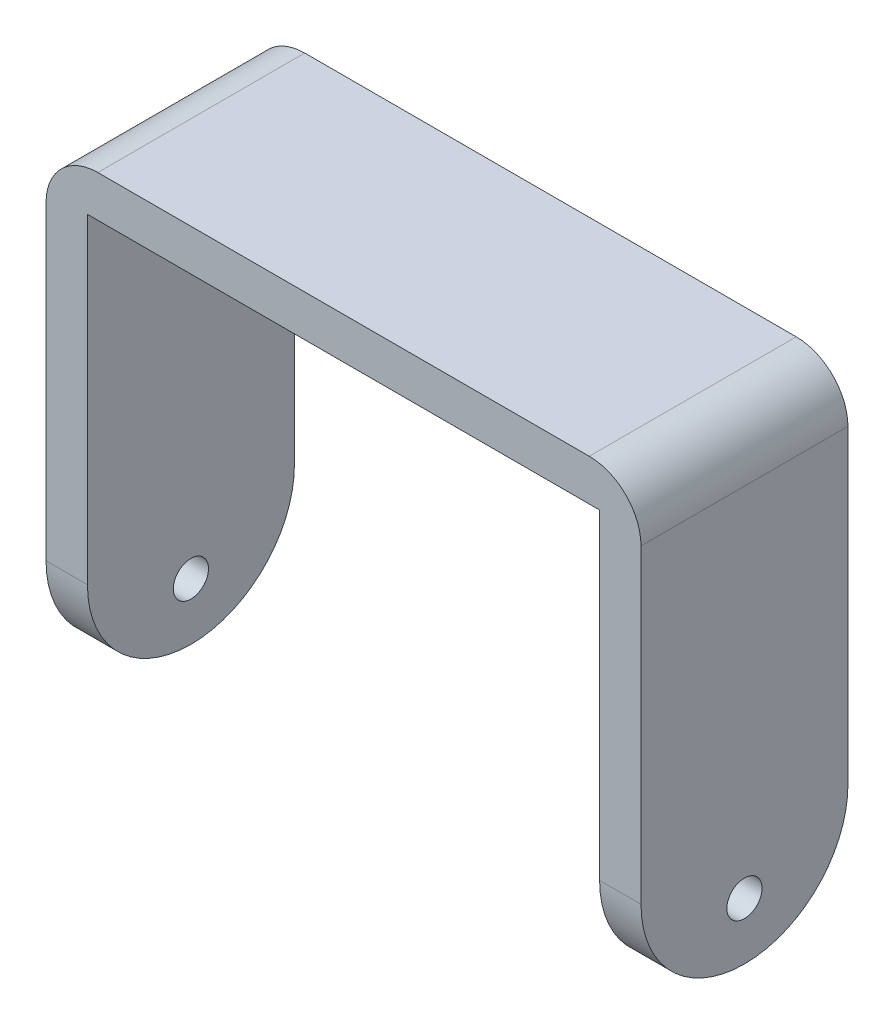
from build123d import *

# Parameters (mm, degrees)
BOSS_EXTRU_1_DEPTH      = 20
ENL_V_MAT_EXTRU_1_REACH = 77.705
ESQUISSE2_R             = 1.5
D_GAGEMENT_M31_D        = 3.4
D_GAGEMENT_M31_DEPTH    = 57.5
D_GAGEMENT_M31_TIP      = 1.021463052
CONG_1_R                = 10
CONG_2_R                = 5


with BuildPart() as part:
    # Esquisse1 → Boss.-Extru.1 (new body)
    with BuildSketch(Plane.XY):
        Polygon((0, 0), (4, 0), (4, 41), (53.5, 41), (53.5, 0), (57.5, 0), (57.5, 45), (0, 45), align=None)
    extrude(amount=BOSS_EXTRU_1_DEPTH)

    # Enlèv. mat.-Extru.1: up to this face of the body (flat: up to its plane)
    enl_v_mat_extru_1_end = Plane(part.part.faces().sort_by_distance((0, 22.5, 10))[0])
    # Esquisse2 → Enlèv. mat.-Extru.1 (cut, up to the picked face)
    with BuildSketch(Plane(origin=(57.5, 0, 0), x_dir=(0, 0, -1), z_dir=(1, 0, 0)), mode=Mode.PRIVATE) as enl_v_mat_extru_1_sk1:
        with Locations((-10, 5.5)):
            Circle(ESQUISSE2_R)
    enl_v_mat_extru_1_tool1 = split(extrude(enl_v_mat_extru_1_sk1.sketch, amount=-ENL_V_MAT_EXTRU_1_REACH, mode=Mode.PRIVATE), bisect_by=enl_v_mat_extru_1_end, keep=Keep.BOTH, mode=Mode.PRIVATE)
    add(enl_v_mat_extru_1_tool1.solids().sort_by(Axis((57.5, 5.5, 10), (-1, 0, 0)))[0], mode=Mode.SUBTRACT)

    # Dégagement M31
    with Locations(Plane(origin=(57.5, 0, 0), x_dir=(0, 0, -1), z_dir=(1, 0, 0))):
        with Locations((-10, 5.5)):
            Hole(D_GAGEMENT_M31_D / 2, depth=D_GAGEMENT_M31_DEPTH)
            with Locations((0, 0, -(D_GAGEMENT_M31_DEPTH + D_GAGEMENT_M31_TIP / 2))):  # 118° drill point
                Cone(0, D_GAGEMENT_M31_D / 2, D_GAGEMENT_M31_TIP, mode=Mode.SUBTRACT)

    # Congé1
    cong_1_edges = [part.edges().sort_by_distance(p)[0] for p in [
        (55.5, 0, 0),
        (55.5, 0, 20),
        (2, 0, 0),
        (2, 0, 20),
    ]]
    fillet(cong_1_edges, radius=CONG_1_R - 0.0001)  # a hair under: the kernel refuses the full size

    # Congé2
    cong_2_edges = [part.edges().sort_by_distance(p)[0] for p in [
        (0, 45, 10),
        (57.5, 45, 10),
    ]]
    fillet(cong_2_edges, radius=CONG_2_R)


solid = part.part
